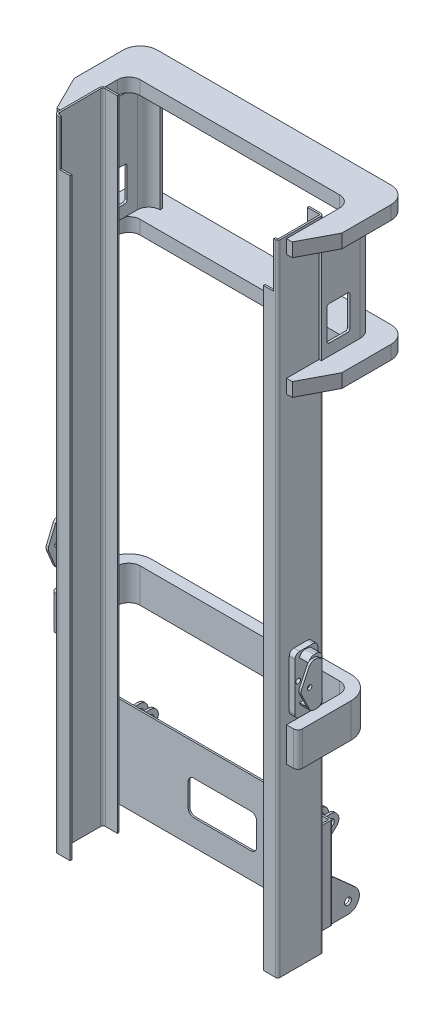
from build123d import *

# Parameters (mm, degrees)
EXTRUDE_THIN1_DEPTH      = 1400
CUT_EXTRUDE1_REACH       = 1496.419
SKETCH2_W                = 45
SKETCH2_H                = 200
EXTRUDE_THIN2_DEPTH      = 1400
SKETCH6_W                = 45
SKETCH6_H                = 200
CUT_EXTRUDE2_DEPTH       = 7.5
EXTRUDE_THIN3_START      = -75
EXTRUDE_THIN3_DEPTH      = 400
FILLET1_R                = 5
SKETCH9_W                = 300
SKETCH9_H                = 150
CUT_EXTRUDE3_DEPTH       = 7.5
FILLET2_R                = 25
BOSS_EXTRUDE1_START      = -50
SKETCH11_R               = 15
BOSS_EXTRUDE1_DEPTH      = 10
LPATTERN1_COUNT          = 2
LPATTERN1_PITCH          = 45
MIRROR11_START           = -50
MIRROR11_COPY_1_SKETCH_R = 15
MIRROR11_COPY_1_DEPTH    = 10
BOSS_EXTRUDE2_START      = -5
SKETCH12_R               = 15
BOSS_EXTRUDE2_DEPTH      = 10
BOSS_EXTRUDE3_START      = -600
BOSS_EXTRUDE3_DEPTH      = 60
LPATTERN2_COUNT          = 2
LPATTERN2_PITCH          = 530
EXTRUDE_THIN4_DEPTH      = 470
CUT_EXTRUDE4_DEPTH       = 10
BOSS_EXTRUDE4_DEPTH      = 25
SKETCH17_W               = 60
SKETCH17_H               = 210
BOSS_EXTRUDE5_DEPTH      = 40
SKETCH18_W               = 20
SKETCH18_H               = 170
CUT_EXTRUDE5_DEPTH       = 40
BOSS_EXTRUDE6_DEPTH      = 10
CUT_EXTRUDE6_REACH       = 1850.462
SKETCH21_R               = 10
FILLET3_R                = 25
FILLET4_R                = 25
BOSS_EXTRUDE7_START      = 25
BOSS_EXTRUDE7_DEPTH      = 25
SKETCH27_W               = 60
SKETCH27_H               = 210
BOSS_EXTRUDE8_DEPTH      = 40
SKETCH28_W               = 20
SKETCH28_H               = 170
CUT_EXTRUDE8_DEPTH       = 40
BOSS_EXTRUDE10_DEPTH     = 10
CUT_EXTRUDE9_REACH       = 1850.33
SKETCH31_R               = 10
FILLET5_R                = 25
FILLET6_R                = 25
BOSS_EXTRUDE14_START     = 175
BOSS_EXTRUDE14_DEPTH     = 150
FILLET7_R                = 20
SKETCH34_W               = 40
SKETCH34_H               = 160
CUT_EXTRUDE10_DEPTH      = 70
SKETCH35_W               = 40
SKETCH35_H               = 160
CUT_EXTRUDE11_DEPTH      = 90


with BuildPart() as part:
    # Sketch1 → Extrude-Thin1 (new, symmetric)
    with BuildSketch(Plane(origin=(0, 0, 0), x_dir=(1, 0, 0), z_dir=(0, 1, 0))):
        with BuildLine():
            Line((420, 100), (473, 100))
            ThreePointArc((473, 100), (480.071067812, 97.071067812), (483, 90))
            Line((483, 90), (483, -90))
            ThreePointArc((483, -90), (480.071067812, -97.071067812), (473, -100))
            Line((473, -100), (420, -100))
            Line((420, -100), (420, -92.5))
            Line((420, -92.5), (473, -92.5))
            ThreePointArc((473, -92.5), (474.767766953, -91.767766953), (475.5, -90))
            Line((475.5, -90), (475.5, 90))
            ThreePointArc((475.5, 90), (474.767766953, 91.767766953), (473, 92.5))
            Line((473, 92.5), (420, 92.5))
            Line((420, 92.5), (420, 100))
        make_face()
    extrude(amount=EXTRUDE_THIN1_DEPTH, both=True)

    # Sketch2 → Cut-Extrude1 (cut, up to next)
    with BuildSketch(Plane.XY.offset(100), mode=Mode.PRIVATE) as cut_extrude1_sk1:
        with Locations((442.5, 1300)):
            Rectangle(SKETCH2_W, SKETCH2_H)
    cut_extrude1_tool1 = extrude(cut_extrude1_sk1.sketch, amount=-CUT_EXTRUDE1_REACH, mode=Mode.PRIVATE) & part.part
    add(cut_extrude1_tool1.solids().sort_by_distance((442.5, 1300, 100))[0], mode=Mode.SUBTRACT)



with BuildPart() as body_2:
    # Sketch5 → Extrude-Thin2 (new, symmetric)
    with BuildSketch(Plane(origin=(0, 0, 0), x_dir=(1, 0, 0), z_dir=(0, 1, 0))):
        with BuildLine():
            Line((-420, 100), (-473, 100))
            ThreePointArc((-473, 100), (-480.071067812, 97.071067812), (-483, 90))
            Line((-483, 90), (-483, -90))
            ThreePointArc((-483, -90), (-480.071067812, -97.071067812), (-473, -100))
            Line((-473, -100), (-420, -100))
            Line((-420, -100), (-420, -107.5))
            Line((-420, -107.5), (-473, -107.5))
            ThreePointArc((-473, -107.5), (-485.374368671, -102.374368671), (-490.5, -90))
            Line((-490.5, -90), (-490.5, 90))
            ThreePointArc((-490.5, 90), (-485.374368671, 102.374368671), (-473, 107.5))
            Line((-473, 107.5), (-420, 107.5))
            Line((-420, 107.5), (-420, 100))
        make_face()
    extrude(amount=EXTRUDE_THIN2_DEPTH, both=True)

    # Sketch6 → Cut-Extrude2 (cut)
    with BuildSketch(Plane.XY.offset(107.5)):
        with Locations((-442.5, 1300)):
            Rectangle(SKETCH6_W, SKETCH6_H)
    extrude(amount=-CUT_EXTRUDE2_DEPTH, mode=Mode.SUBTRACT)

    # Sketch13 → Boss-Extrude3 (add)
    with BuildSketch(Plane(origin=(0, 1400, 0), x_dir=(1, 0, 0), z_dir=(0, 1, 0)).offset(BOSS_EXTRUDE3_START)):
        with BuildLine():
            Line((-515.5, -69.5), (-490.5, -69.5))
            Line((-490.5, -69.5), (-490.5, 170.5))
            ThreePointArc((-490.5, 170.5), (-475.855339059, 205.855339059), (-440.5, 220.5))
            Line((-440.5, 220.5), (0, 220.5))
            Line((0, 220.5), (0, 370.488465608))
            Line((0, 370.488465608), (-515.5, 370.5))
            ThreePointArc((-515.5, 370.5), (-568.533008589, 348.533008589), (-590.5, 295.5))
            Line((-590.5, 295.5), (-590.5, 80.5))
            Line((-590.5, 80.5), (-515.5, -69.5))
        make_face()
        with BuildLine():
            Line((0, 370.488465608), (0, 220.5))
            Line((0, 220.5), (433.212083537, 220.5))
            ThreePointArc((433.212083537, 220.5), (468.56744661, 205.855315046), (483.212083537, 170.49993208))
            Line((483.212083537, 170.49993208), (483.211767709, -62))
            Line((483.211767709, -62), (508.211767709, -62))
            Line((508.211767709, -62), (583.211961281, 80.5))
            Line((583.211961281, 80.5), (583.212253306, 295.477345626))
            ThreePointArc((583.212253306, 295.477345626), (561.16444596, 348.591149064), (507.983743608, 370.477099394))
            Line((507.983743608, 370.477099394), (0, 370.488465608))
        make_face()
    boss_extrude3 = extrude(amount=BOSS_EXTRUDE3_DEPTH)

    # LPattern2: Boss-Extrude3 ×2
    with Locations(*[(0, i * LPATTERN2_PITCH, 0) for i in range(1, LPATTERN2_COUNT)]):
        add(boss_extrude3)


with BuildPart() as body_3:
    # Sketch7 → Extrude-Thin3 (new body)
    with BuildSketch(Plane.XZ.offset(1400).offset(EXTRUDE_THIN3_START)):
        Polygon((473, -100), (473, -147.5), (-473, -147.5), (-473, -107.5), (-465.5, -107.5), (-465.5, -140), (465.5, -140), (465.5, -100), align=None)
    extrude(amount=-EXTRUDE_THIN3_DEPTH)

    # Fillet1
    fillet1_edges = [body_3.edges().sort_by_distance(p)[0] for p in [
        (473, -1125, -147.5),
        (-473, -1125, -147.5),
    ]]
    fillet(fillet1_edges, radius=FILLET1_R)

    # Sketch9 → Cut-Extrude3 (cut)
    with BuildSketch(Plane(origin=(0, 0, -147.5), x_dir=(-1, 0, 0), z_dir=(0, 0, -1))):
        with Locations((0, -1137.992651422)):
            Rectangle(SKETCH9_W, SKETCH9_H)
    extrude(amount=-CUT_EXTRUDE3_DEPTH, mode=Mode.SUBTRACT)

    # Fillet2
    fillet2_edges = [body_3.edges().sort_by_distance(p)[0] for p in [
        (150, -1212.992651422, -143.75),
        (150, -1062.992651422, -143.75),
        (-150, -1062.992651422, -143.75),
        (-150, -1212.992651422, -143.75),
    ]]
    fillet(fillet2_edges, radius=FILLET2_R)

    # Sketch11 → Boss-Extrude1 (add)
    with BuildSketch(Plane(origin=(473, 0, 0), x_dir=(0, 0, -1), z_dir=(1, 0, 0)).offset(BOSS_EXTRUDE1_START)):
        with BuildLine():
            Line((147.5, -950), (192.5, -950))
            ThreePointArc((192.5, -950), (225.055636783, -972.149688189), (216.405719078, -1010.56397065))
            Line((216.405719078, -1010.56397065), (147.5, -1075))
            Line((147.5, -1075), (147.5, -950))
        make_face()
        with Locations((192.5, -985)):
            Circle(SKETCH11_R, mode=Mode.SUBTRACT)
    boss_extrude1 = extrude(amount=-BOSS_EXTRUDE1_DEPTH)

    # LPattern1: Boss-Extrude1 ×2
    with Locations(*[(-i * LPATTERN1_PITCH, 0, 0) for i in range(1, LPATTERN1_COUNT)]):
        add(boss_extrude1)

    # Mirror11: Boss-Extrude1 across plane
    add(boss_extrude1.mirror(Plane(origin=(0, 0, 0), x_dir=(0, 0, 1), z_dir=(1, 0, 0))))

    # Mirror11 copy 1 sketch → Mirror11 copy 1 (add)
    with BuildSketch(Plane(origin=(-428, 0, 0), x_dir=(0, 0, -1), z_dir=(-1, 0, 0)).offset(MIRROR11_START)):
        with BuildLine():
            Line((147.5, 950), (192.5, 950))
            ThreePointArc((192.5, 950), (225.055636783, 972.149688189), (216.405719078, 1010.56397065))
            Line((216.405719078, 1010.56397065), (147.5, 1075))
            Line((147.5, 1075), (147.5, 950))
        make_face()
        with Locations((192.5, 985)):
            Circle(MIRROR11_COPY_1_SKETCH_R, mode=Mode.SUBTRACT)
    extrude(amount=-MIRROR11_COPY_1_DEPTH)

    # Sketch12 → Boss-Extrude2 (add)
    with BuildSketch(Plane(origin=(473, 0, 0), x_dir=(0, 0, -1), z_dir=(1, 0, 0)).offset(BOSS_EXTRUDE2_START)):
        with BuildLine():
            Line((147.5, -1325), (222.5, -1325))
            ThreePointArc((222.5, -1325), (269.219701801, -1292.812059501), (255.786964333, -1237.690778547))
            Line((255.786964333, -1237.690778547), (157.5, -1150))
            Line((157.5, -1150), (147.5, -1150))
            Line((147.5, -1150), (147.5, -1325))
        make_face()
        with Locations((222.5, -1275)):
            Circle(SKETCH12_R, mode=Mode.SUBTRACT)
    boss_extrude2 = extrude(amount=-BOSS_EXTRUDE2_DEPTH)

    # Mirror13: Boss-Extrude2 across plane
    add(boss_extrude2.mirror(Plane(origin=(0, 0, 0), x_dir=(0, 0, 1), z_dir=(1, 0, 0))))


with BuildPart() as part_1:
    add(part.part)

    add(body_2.part)  # Extrude-Thin4 merges body 2
    # Sketch14 → Extrude-Thin4 (add)
    with BuildSketch(Plane(origin=(0, 860, 0), x_dir=(1, 0, 0), z_dir=(0, 1, 0))):
        with BuildLine():
            Line((483, 80.5), (483, 250))
            ThreePointArc((483, 250), (468.355339059, 285.355339059), (433, 300))
            Line((433, 300), (433, 310))
            ThreePointArc((433, 310), (475.426406871, 292.426406871), (493, 250))
            Line((493, 250), (493, 80.5))
            Line((493, 80.5), (483, 80.5))
        make_face()
    extrude_thin4 = extrude(amount=EXTRUDE_THIN4_DEPTH)

    # Sketch15 → Cut-Extrude4 (cut)
    with BuildSketch(Plane(origin=(493, 0, 0), x_dir=(0, 0, -1), z_dir=(1, 0, 0))):
        with BuildLine():
            Line((195.5, 910), (115.5, 910))
            ThreePointArc((115.5, 910), (108.428932188, 912.928932188), (105.5, 920))
            Line((105.5, 920), (105.5, 1050))
            ThreePointArc((105.5, 1050), (108.428932188, 1057.071067812), (115.5, 1060))
            Line((115.5, 1060), (195.5, 1060))
            ThreePointArc((195.5, 1060), (202.571067812, 1057.071067812), (205.5, 1050))
            Line((205.5, 1050), (205.5, 920))
            ThreePointArc((205.5, 920), (202.571067812, 912.928932188), (195.5, 910))
        make_face()
    cut_extrude4 = extrude(amount=-CUT_EXTRUDE4_DEPTH, mode=Mode.SUBTRACT)

    # Mirror14: Extrude-Thin4, Cut-Extrude4 across plane
    add(extrude_thin4.mirror(Plane(origin=(0, 0, 0), x_dir=(0, 0, 1), z_dir=(1, 0, 0))))
    add(cut_extrude4.mirror(Plane(origin=(0, 0, 0), x_dir=(0, 0, 1), z_dir=(1, 0, 0))), mode=Mode.SUBTRACT)

    # Sketch16 → Boss-Extrude4 (add)
    with BuildSketch(Plane.ZY.offset(490.5)):
        with BuildLine():
            Line((30, -180), (-30, -180))
            ThreePointArc((-30, -180), (-44.142135624, -185.857864376), (-50, -200))
            Line((-50, -200), (-50, -410))
            ThreePointArc((-50, -410), (-44.142135624, -424.142135624), (-30, -430))
            Line((-30, -430), (30, -430))
            ThreePointArc((30, -430), (44.142135624, -424.142135624), (50, -410))
            Line((50, -410), (50, -200))
            ThreePointArc((50, -200), (44.142135624, -185.857864376), (30, -180))
        make_face()
    extrude(amount=BOSS_EXTRUDE4_DEPTH)

    # Sketch17 → Boss-Extrude5 (add)
    with BuildSketch(Plane.ZY.offset(515.5)):
        with Locations((0, -305)):
            Rectangle(SKETCH17_W, SKETCH17_H)
    extrude(amount=BOSS_EXTRUDE5_DEPTH)

    # Sketch18 → Cut-Extrude5 (cut)
    with BuildSketch(Plane.ZY.offset(555.5)):
        with Locations((0, -305)):
            Rectangle(SKETCH18_W, SKETCH18_H)
        with Locations((20, -305)):
            Rectangle(SKETCH18_W, SKETCH18_H)
    extrude(amount=-CUT_EXTRUDE5_DEPTH, mode=Mode.SUBTRACT)

    # Sketch20 → Boss-Extrude6 (add)
    with BuildSketch(Plane.ZY.offset(555.5)):
        Polygon((-21.722122048, -210), (30, -210), (69.498400695, -305), (30, -400), (-21.722122048, -400), align=None)
    extrude(amount=BOSS_EXTRUDE6_DEPTH)

    # Cut-Extrude6: up to this face of the body (flat: up to its plane)
    cut_extrude6_end = Plane(part_1.part.faces().sort_by_distance((-490.5, -40.214303176, 1.265696059))[0])
    # Sketch21 → Cut-Extrude6 (cut, up to the picked face)
    with BuildSketch(Plane.ZY.offset(565.5), mode=Mode.PRIVATE) as cut_extrude6_sk1:
        with Locations((29.498400695, -305)):
            Circle(SKETCH21_R)
    cut_extrude6_tool1 = split(extrude(cut_extrude6_sk1.sketch, amount=-CUT_EXTRUDE6_REACH, mode=Mode.PRIVATE), bisect_by=cut_extrude6_end, keep=Keep.BOTH, mode=Mode.PRIVATE)
    add(cut_extrude6_tool1.solids().sort_by(Axis((-565.5, -305, 29.498401), (1, 0, 0)))[0], mode=Mode.SUBTRACT)

    # Fillet3
    # the kernel refuses this fillet: 25 mm, written as the material it takes off along each edge
    with BuildSketch(Plane(origin=(-515.5, -200, -30), x_dir=(0, -1, 0), z_dir=(-1, 0, 0)), Plane(origin=(-515.5, -410, -30), x_dir=(0, 0, 1), z_dir=(-1, 0, 0))) as fillet3_piece_1:
        with BuildLine():
            CenterArc((FILLET3_R, FILLET3_R), FILLET3_R, 180, 90)
            Line((0, FILLET3_R), (0, 0))
            Line((0, 0), (FILLET3_R, 0))
        make_face()
    extrude(amount=102.5, mode=Mode.SUBTRACT)
    with BuildSketch(Plane(origin=(-515.5, -410, 30), x_dir=(0, 0, -1), z_dir=(-1, 0, 0))) as fillet3_piece_2:
        with BuildLine():
            CenterArc((24.494897428, -25), FILLET3_R, 90, 78.463040967)
            Line((0, -20), (0, 0))
            Line((0, 0), (24.494897428, 0))
        make_face()
    extrude(amount=40, mode=Mode.SUBTRACT)
    with BuildSketch(Plane(origin=(-529.514210069, -305, 69.498400695), x_dir=(0, 0.9233697384578038, -0.383911872830689), z_dir=(-1, 0, 0))) as fillet3_piece_3:
        with BuildLine():
            CenterArc((FILLET3_R * 0.415772638891, FILLET3_R), FILLET3_R, 224.847590805, 45.152409195)
            Line((-FILLET3_R * 0.293212572322, FILLET3_R * 0.294776652201), (0, 0))
            Line((0, 0), (FILLET3_R * 0.415772638891, 0))
        make_face()
    extrude(amount=61.971579861, mode=Mode.SUBTRACT)
    with BuildSketch(Plane(origin=(-515.5, -200, 30), x_dir=(0, 0, -1), z_dir=(-1, 0, 0))) as fillet3_piece_4:
        with BuildLine():
            CenterArc((24.494897428, 25), FILLET3_R, 191.536959033, 78.463040967)
            Line((0, 20), (0, 0))
            Line((0, 0), (24.494897428, 0))
        make_face()
    extrude(amount=40, mode=Mode.SUBTRACT)

    # Fillet4
    # the kernel refuses this fillet: 25 mm, written as the material it takes off along each edge
    with BuildSketch(Plane(origin=(-555.5, -210, -21.722122048), x_dir=(0, -1, 0), z_dir=(-1, 0, 0))) as fillet4_piece_1:
        with BuildLine():
            CenterArc((FILLET4_R, FILLET4_R), FILLET4_R, 180, 90)
            Line((0, FILLET4_R), (0, 0))
            Line((0, 0), (FILLET4_R, 0))
        make_face()
    extrude(amount=72.5, mode=Mode.SUBTRACT)
    with BuildSketch(Plane(origin=(-555.5, -400, -21.722122048), x_dir=(0, 1, 0), z_dir=(-1, 0, 0))) as fillet4_piece_2:
        with BuildLine():
            CenterArc((FILLET4_R, -FILLET4_R), FILLET4_R, 90, 90)
            Line((0, -FILLET4_R), (0, 0))
            Line((0, 0), (FILLET4_R, 0))
        make_face()
    extrude(amount=72.5, mode=Mode.SUBTRACT)
    with BuildSketch(Plane(origin=(-555.5, -400, 30), x_dir=(0, 0, -1), z_dir=(-1, 0, 0))) as fillet4_piece_3:
        with BuildLine():
            CenterArc((FILLET4_R * 0.667217152035, -FILLET4_R), FILLET4_R, 90, 67.423795402)
            Line((-FILLET4_R * 0.256152586423, -FILLET4_R * 0.616088127169), (0, 0))
            Line((0, 0), (FILLET4_R * 0.667217152035, 0))
        make_face()
    extrude(amount=51.701072002, mode=Mode.SUBTRACT)
    with BuildSketch(Plane(origin=(-555.5, -210, 30), x_dir=(0, 0, -1), z_dir=(-1, 0, 0))) as fillet4_piece_4:
        with BuildLine():
            CenterArc((FILLET4_R * 0.667217152035, FILLET4_R), FILLET4_R, 202.576204598, 67.423795402)
            Line((-FILLET4_R * 0.256152586423, FILLET4_R * 0.616088127169), (0, 0))
            Line((0, 0), (FILLET4_R * 0.667217152035, 0))
        make_face()
    extrude(amount=51.701072002, mode=Mode.SUBTRACT)

    # Sketch26 → Boss-Extrude7 (add)
    with BuildSketch(Plane(origin=(483, 0, 0), x_dir=(0, 0, -1), z_dir=(1, 0, 0)).offset(BOSS_EXTRUDE7_START)):
        with BuildLine():
            Line((30, -180), (-30, -180))
            ThreePointArc((-30, -180), (-44.142135624, -185.857864376), (-50, -200))
            Line((-50, -200), (-50, -410))
            ThreePointArc((-50, -410), (-44.142135624, -424.142135624), (-30, -430))
            Line((-30, -430), (30, -430))
            ThreePointArc((30, -430), (44.142135624, -424.142135624), (50, -410))
            Line((50, -410), (50, -200))
            ThreePointArc((50, -200), (44.142135624, -185.857864376), (30, -180))
        make_face()
    extrude(amount=-BOSS_EXTRUDE7_DEPTH)

    # Sketch27 → Boss-Extrude8 (add)
    with BuildSketch(Plane(origin=(508, 0, 0), x_dir=(0, 0, -1), z_dir=(1, 0, 0))):
        with Locations((0, -289.47112795)):
            Rectangle(SKETCH27_W, SKETCH27_H)
    extrude(amount=BOSS_EXTRUDE8_DEPTH)

    # Sketch28 → Cut-Extrude8 (cut)
    with BuildSketch(Plane(origin=(548, 0, 0), x_dir=(0, 0, -1), z_dir=(1, 0, 0))):
        with Locations((-20, -289.47112795)):
            Rectangle(SKETCH28_W, SKETCH28_H)
        with Locations((0, -289.47112795)):
            Rectangle(SKETCH28_W, SKETCH28_H)
    extrude(amount=-CUT_EXTRUDE8_DEPTH, mode=Mode.SUBTRACT)

    # Sketch30 → Boss-Extrude10 (add)
    with BuildSketch(Plane(origin=(548, 0, 0), x_dir=(0, 0, -1), z_dir=(1, 0, 0))):
        Polygon((19.345982884, -194.47112795), (-30, -194.47112795), (-75.777343013, -289.47112795), (-30, -384.47112795), (19.345982884, -384.47112795), align=None)
    extrude(amount=BOSS_EXTRUDE10_DEPTH)

    # Cut-Extrude9: up to this face of the body (flat: up to its plane)
    cut_extrude9_end = Plane(part_1.part.faces().sort_by_distance((483, 5.540575248, 0.801555261))[0])
    # Sketch31 → Cut-Extrude9 (cut, up to the picked face)
    with BuildSketch(Plane(origin=(558, 0, 0), x_dir=(0, 0, -1), z_dir=(1, 0, 0)), mode=Mode.PRIVATE) as cut_extrude9_sk1:
        with Locations((-35.777343013, -289.47112795)):
            Circle(SKETCH31_R)
    cut_extrude9_tool1 = split(extrude(cut_extrude9_sk1.sketch, amount=-CUT_EXTRUDE9_REACH, mode=Mode.PRIVATE), bisect_by=cut_extrude9_end, keep=Keep.BOTH, mode=Mode.PRIVATE)
    add(cut_extrude9_tool1.solids().sort_by(Axis((558, -289.471128, 35.777343), (-1, 0, 0)))[0], mode=Mode.SUBTRACT)

    # Fillet5
    # the kernel refuses this fillet: 25 mm, written as the material it takes off along each edge
    with BuildSketch(Plane(origin=(508, -394.47112795, -30), x_dir=(0, 0, 1), z_dir=(1, 0, 0)), Plane(origin=(508, -184.47112795, -30), x_dir=(0, -1, 0), z_dir=(1, 0, 0))) as fillet5_piece_1:
        with BuildLine():
            CenterArc((FILLET5_R, -FILLET5_R), FILLET5_R, 90, 90)
            Line((0, -FILLET5_R), (0, 0))
            Line((0, 0), (FILLET5_R, 0))
        make_face()
    extrude(amount=102.5, mode=Mode.SUBTRACT)
    with BuildSketch(Plane(origin=(508, -184.47112795, 30), x_dir=(0, 0, -1), z_dir=(1, 0, 0))) as fillet5_piece_2:
        with BuildLine():
            CenterArc((24.494897428, -25), FILLET5_R, 90, 78.463040967)
            Line((0, -20), (0, 0))
            Line((0, 0), (24.494897428, 0))
        make_face()
    extrude(amount=40, mode=Mode.SUBTRACT)
    with BuildSketch(Plane(origin=(508, -394.47112795, 30), x_dir=(0, 0, -1), z_dir=(1, 0, 0))) as fillet5_piece_3:
        with BuildLine():
            CenterArc((24.494897428, 25), FILLET5_R, 191.536959033, 78.463040967)
            Line((0, 20), (0, 0))
            Line((0, 0), (24.494897428, 0))
        make_face()
    extrude(amount=40, mode=Mode.SUBTRACT)
    with BuildSketch(Plane(origin=(517.883326965, -289.47112795, 75.777343013), x_dir=(0, 0.9008659583335598, -0.4340973682432976), z_dir=(1, 0, 0))) as fillet5_piece_4:
        with BuildLine():
            CenterArc((FILLET5_R * 0.481866768555, -FILLET5_R), FILLET5_R, 90, 51.455743835)
            Line((-FILLET5_R * 0.30026031475, -FILLET5_R * 0.376881050232), (0, 0))
            Line((0, 0), (FILLET5_R * 0.481866768555, 0))
        make_face()
    extrude(amount=70.233346069, mode=Mode.SUBTRACT)

    # Fillet6
    # the kernel refuses this fillet: 25 mm, written as the material it takes off along each edge
    with BuildSketch(Plane(origin=(548, -384.47112795, -19.345982884), x_dir=(0, 0, 1), z_dir=(1, 0, 0)), Plane(origin=(548, -194.47112795, -19.345982884), x_dir=(0, -1, 0), z_dir=(1, 0, 0))) as fillet6_piece_1:
        with BuildLine():
            CenterArc((FILLET6_R, -FILLET6_R), FILLET6_R, 90, 90)
            Line((0, -FILLET6_R), (0, 0))
            Line((0, 0), (FILLET6_R, 0))
        make_face()
    extrude(amount=72.5, mode=Mode.SUBTRACT)
    with BuildSketch(Plane(origin=(548, -194.47112795, 30), x_dir=(0, 0, -1), z_dir=(1, 0, 0))) as fillet6_piece_2:
        with BuildLine():
            CenterArc((FILLET6_R * 0.628176285852, -FILLET6_R), FILLET6_R, 90, 64.272128082)
            Line((-FILLET6_R * 0.272689672481, -FILLET6_R * 0.565902631757), (0, 0))
            Line((0, 0), (FILLET6_R * 0.628176285852, 0))
        make_face()
    extrude(amount=49.261017866, mode=Mode.SUBTRACT)
    with BuildSketch(Plane(origin=(548, -384.47112795, 30), x_dir=(0, 0, -1), z_dir=(1, 0, 0))) as fillet6_piece_3:
        with BuildLine():
            CenterArc((FILLET6_R * 0.628176285852, FILLET6_R), FILLET6_R, 205.727871918, 64.272128082)
            Line((-FILLET6_R * 0.272689672481, FILLET6_R * 0.565902631757), (0, 0))
            Line((0, 0), (FILLET6_R * 0.628176285852, 0))
        make_face()
    extrude(amount=49.261017866, mode=Mode.SUBTRACT)

    # Sketch33 → Boss-Extrude14 (add)
    with BuildSketch(Plane.XZ.offset(430).offset(BOSS_EXTRUDE14_START)):
        with BuildLine():
            Line((-490.5, -90), (-490.5, 69.5))
            Line((-490.5, 69.5), (-540.5, 69.5))
            Line((-540.5, 69.5), (-540.5, -90))
            Line((-540.5, -90), (-540.5, -170.5))
            ThreePointArc((-540.5, -170.5), (-511.210678119, -241.210678119), (-440.5, -270.5))
            Line((-440.5, -270.5), (433.212083537, -270.5))
            ThreePointArc((433.212083537, -270.5), (503.922809682, -241.210630092), (533.212083537, -170.49986416))
            Line((533.212083537, -170.49986416), (533.211767709, 62.00006792))
            Line((533.211767709, 62.00006792), (483.211767709, 62))
            Line((483.211767709, 62), (483.212083537, -170.49993208))
            ThreePointArc((483.212083537, -170.49993208), (468.56744661, -205.855315046), (433.212083537, -220.5))
            Line((433.212083537, -220.5), (-440.5, -220.5))
            ThreePointArc((-440.5, -220.5), (-475.855339059, -205.855339059), (-490.5, -170.5))
            Line((-490.5, -170.5), (-490.5, -90))
        make_face()
    extrude(amount=-BOSS_EXTRUDE14_DEPTH)

    # Fillet7
    fillet7_edges = [part_1.edges().sort_by_distance(p)[0] for p in [
        (533.211767709, -530, 62.00006792),
        (-540.5, -530, 69.5),
    ]]
    fillet(fillet7_edges, radius=FILLET7_R)

    # Sketch34 → Cut-Extrude10 (cut)
    with BuildSketch(Plane(origin=(0, 0, -30), x_dir=(-1, 0, 0), z_dir=(0, 0, -1))):
        with Locations((-528, -289.47112795)):
            Rectangle(SKETCH34_W, SKETCH34_H)
    extrude(amount=-CUT_EXTRUDE10_DEPTH, mode=Mode.SUBTRACT)

    # Sketch35 → Cut-Extrude11 (cut)
    with BuildSketch(Plane(origin=(0, 0, -30), x_dir=(-1, 0, 0), z_dir=(0, 0, -1))):
        with Locations((535.5, -305)):
            Rectangle(SKETCH35_W, SKETCH35_H)
    extrude(amount=-CUT_EXTRUDE11_DEPTH, mode=Mode.SUBTRACT)


solid = Compound([body_3.part, part_1.part])
